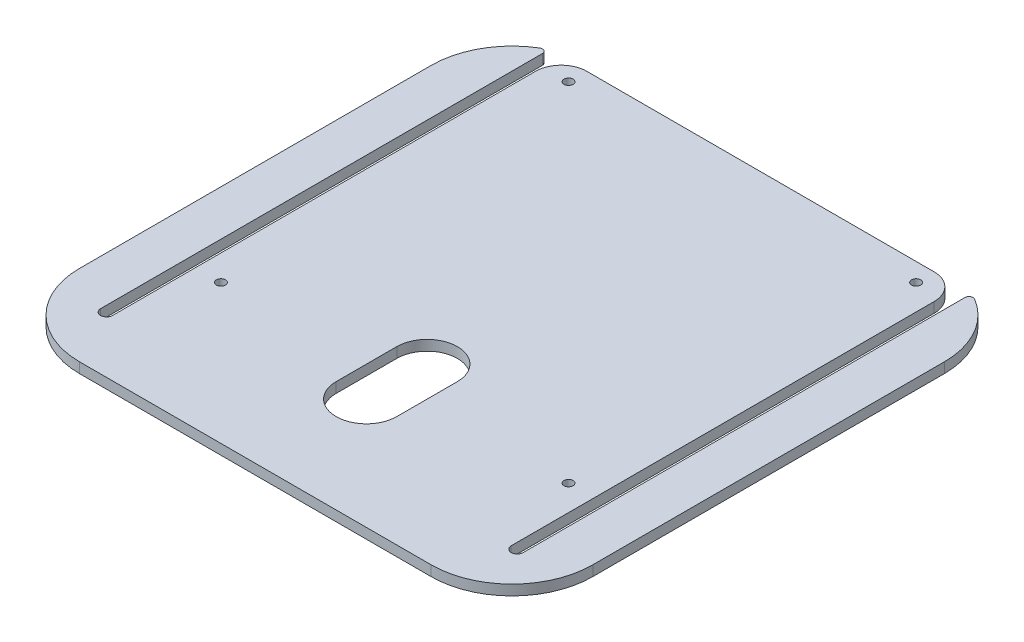
from build123d import *

# Parameters (mm, degrees)
SKETCH1_R             = 1.13
BOSS_EXTRUDE1_DEPTH   = 2.54
FILLET1_R             = 20
FILLET6_R             = 6.35
FILLET7_R             = 1
F_4_40_TAPPED_HOLE1_D = 2.2606


with BuildPart() as part:
    # Sketch1 → Boss-Extrude1 (new body)
    with BuildSketch(Plane(origin=(0, 0, 0), x_dir=(1, 0, 0), z_dir=(0, 1, 0))):
        with BuildLine():
            Line((11.225, 0), (0, 0))
            Line((0, 0), (0, -125))
            Line((0, -125), (127, -125))
            Line((127, -125), (127, 0))
            Line((127, 0), (115.775, 0))
            Line((115.775, 0), (115.775, -111))
            ThreePointArc((115.775, -111), (114.3, -112.475), (112.825, -111))
            Line((112.825, -111), (112.825, 0))
            Line((112.825, 0), (14.175, 0))
            Line((14.175, 0), (14.175, -111))
            ThreePointArc((14.175, -111), (12.7, -112.475), (11.225, -111))
            Line((11.225, -111), (11.225, 0))
        make_face()
        with BuildLine():
            ThreePointArc((71, -97.5), (63.5, -105), (56, -97.5))
            Line((56, -97.5), (56, -82.5))
            ThreePointArc((56, -82.5), (63.5, -75), (71, -82.5))
            Line((71, -82.5), (71, -97.5))
        make_face(mode=Mode.SUBTRACT)
        with Locations(Location((106.5, -4.5, 0), (0, 0, 270))):
            Circle(SKETCH1_R, mode=Mode.SUBTRACT)
        with Locations(Location((20.5, -90.5, 0), (0, 0, 270))):
            Circle(SKETCH1_R, mode=Mode.SUBTRACT)
        with Locations(Location((106.5, -90.5, 0), (0, 0, 270))):
            Circle(SKETCH1_R, mode=Mode.SUBTRACT)
        with Locations(Location((20.5, -4.5, 0), (0, 0, 270))):
            Circle(SKETCH1_R, mode=Mode.SUBTRACT)
    extrude(amount=BOSS_EXTRUDE1_DEPTH)

    # Fillet1
    # the kernel refuses this fillet: 20 mm, written as the material it takes off along each edge
    with BuildSketch(Plane(origin=(0, -44.930458419, 0), x_dir=(1, 0, 0), z_dir=(0, 1, 0))) as fillet1_piece_1:
        with BuildLine():
            CenterArc((20, -17.972183368), FILLET1_R, 116.024153389, 63.975846611)
            Line((0, -17.972183368), (-0.4, -17.972183368))
            Line((-0.4, -17.972183368), (-0.4, 0))
            Line((-0.4, 0), (0, 0.4))
            ThreePointArc((0, 0.4), (5.6125, 0.4), (11.0495, 0.359443667))
            Line((11.0495, 0.359443667), (11.225, 0))
        make_face()
    extrude(amount=92.400916838, mode=Mode.SUBTRACT)
    with BuildSketch(Plane(origin=(127, -44.930458419, 0), x_dir=(0, 0, 1), z_dir=(0, 1, 0))) as fillet1_piece_2:
        with BuildLine():
            CenterArc((17.972183368, -20), FILLET1_R, 90, 63.975846611)
            Line((0, -11.225), (-0.359443667, -11.0495))
            ThreePointArc((-0.359443667, -11.0495), (-0.4, -5.6125), (-0.4, 0))
            Line((-0.4, 0), (0, 0.4))
            Line((0, 0.4), (17.972183368, 0.4))
            Line((17.972183368, 0.4), (17.972183368, 0))
        make_face()
    extrude(amount=92.400916838, mode=Mode.SUBTRACT)
    with BuildSketch(Plane(origin=(127, -50, 125), x_dir=(-1, 0, 0), z_dir=(0, 1, 0)), Plane(origin=(0, -50, 125), x_dir=(0, 0, -1), z_dir=(0, 1, 0))) as fillet1_piece_3:
        with BuildLine():
            CenterArc((FILLET1_R, -FILLET1_R), FILLET1_R, 90, 90)
            Line((0, -FILLET1_R), (-FILLET1_R * 0.02, -FILLET1_R))
            Line((-FILLET1_R * 0.02, -FILLET1_R), (-FILLET1_R * 0.02, FILLET1_R * 0.02))
            Line((-FILLET1_R * 0.02, FILLET1_R * 0.02), (FILLET1_R, FILLET1_R * 0.02))
            Line((FILLET1_R, FILLET1_R * 0.02), (FILLET1_R, 0))
        make_face()
    extrude(amount=102.54, mode=Mode.SUBTRACT)

    # Fillet6
    fillet6_edges = [part.edges().sort_by_distance(p)[0] for p in [
        (112.825, 1.27, 0),
        (14.175, 1.27, 0),
    ]]
    fillet(fillet6_edges, radius=FILLET6_R)

    # Fillet7
    fillet7_edges = [part.edges().sort_by_distance(p)[0] for p in [
        (115.775, 1.27, 0),
        (11.225, 1.27, 0),
    ]]
    fillet(fillet7_edges, radius=FILLET7_R)

    # #4-40 Tapped Hole1 (through all)
    with Locations(Plane(origin=(106.5, 2.54, 4.5), x_dir=(0, 0, 1), z_dir=(0, 1, 0))):
        with Locations((0, 0), (0, -86), (86, 0), (86, -86)):
            Hole(F_4_40_TAPPED_HOLE1_D / 2)


solid = part.part
